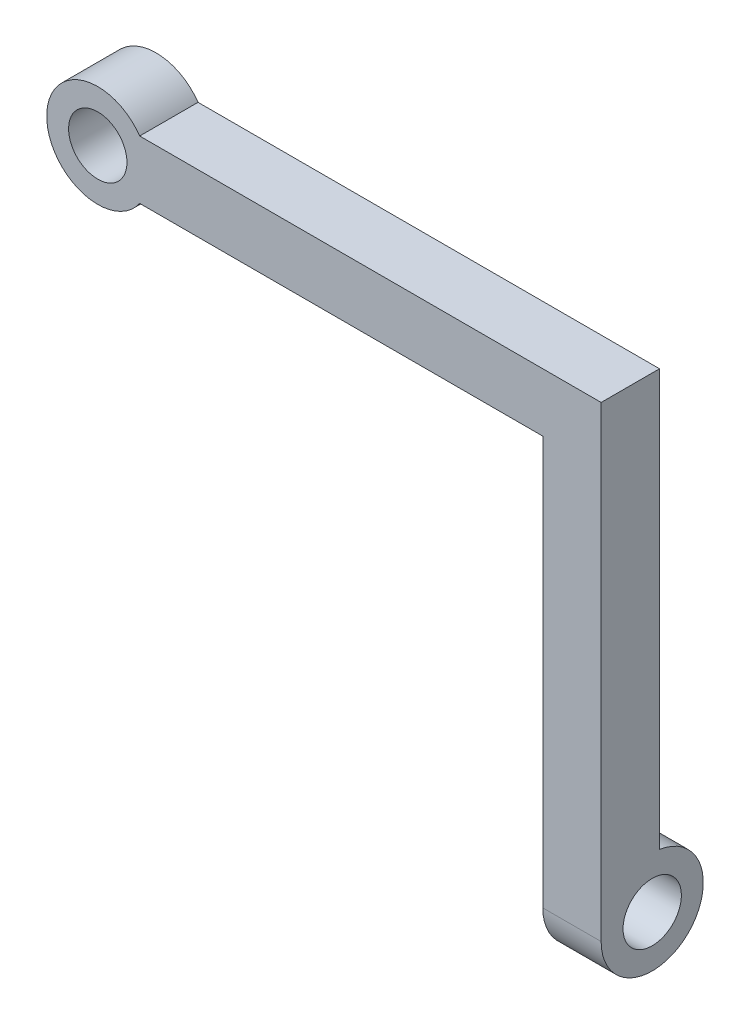
from build123d import *

# Parameters (mm, degrees)
ESBO_O1_R                = 4
RESSALTO_EXTRUS_O1_DEPTH = 14
ESBO_O2_R                = 4
CORTE_EXTRUS_O1_DEPTH    = 103.279030109


with BuildPart() as part:
    # Esboço1 → Ressalto-extrusão1 (new body)
    with BuildSketch(Plane.XY):
        with BuildLine():
            Line((5.744562647, 64), (69, 64))
            Line((69, 64), (69, 32))
            Line((69, 32), (69, -7))
            Line((69, -7), (61, -7))
            Line((61, -7), (61, 7))
            Line((61, 7), (61, 56))
            Line((61, 56), (5.744562647, 56))
            ThreePointArc((5.744562647, 56), (-7, 60), (5.744562647, 64))
        make_face()
        with Locations((0, 60)):
            Circle(ESBO_O1_R, mode=Mode.SUBTRACT)
    extrude(amount=RESSALTO_EXTRUS_O1_DEPTH)

    # Esboço2 → Corte-extrusão1 (cut, through all)
    with BuildSketch(Plane(origin=(69, 0, 0), x_dir=(0, 0, -1), z_dir=(1, 0, 0))):
        with BuildLine():
            Line((0, 67), (-6, 67))
            Line((-6, 67), (-6, 6.92820323))
            ThreePointArc((-6, 6.92820323), (-1.708497378, 4.582575695), (0, 0))
            Line((0, 0), (0, 67))
        make_face()
        with BuildLine():
            Line((0, -7), (0, 0))
            ThreePointArc((0, 0), (-2.050252532, -4.949747468), (-7, -7))
            Line((-7, -7), (0, -7))
        make_face()
        with BuildLine():
            ThreePointArc((-7, -7), (-11.949747469, -4.949747468), (-14, 1e-09))
            Line((-14, 1e-09), (-14, -7))
            Line((-14, -7), (-7, -7))
        make_face()
        with Locations((-7, 0)):
            Circle(ESBO_O2_R)
    extrude(amount=-CORTE_EXTRUS_O1_DEPTH, mode=Mode.SUBTRACT)


solid = part.part
